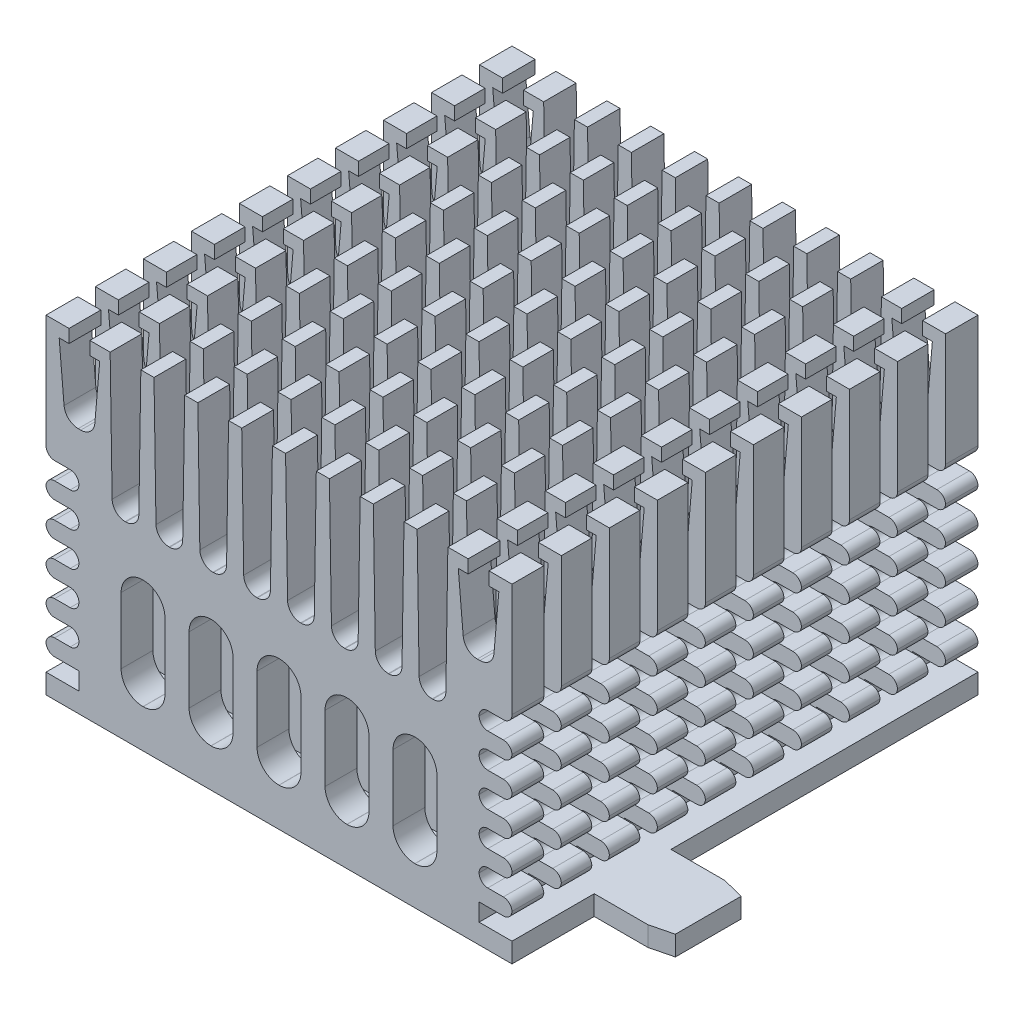
from build123d import *

# Parameters (mm, degrees)
CROQUIS3_W            = 42.5
CROQUIS3_H            = 42.5
EXTRUIR1_DEPTH        = 30
CORTAR_EXTRUIR1_DEPTH = 55
CROQUIS5_W            = 3.649717514
CROQUIS5_H            = 1.6
CORTAR_EXTRUIR2_DEPTH = 55
REDONDEO1_R           = 0.79
REDONDEO2_R           = 0.79
CORTAR_EXTRUIR3_DEPTH = 55
CROQUIS8_W            = 1.6
CROQUIS8_H            = 30.052187853
CORTAR_EXTRUIR4_DEPTH = 55
CROQUIS9_W            = 6.9
CROQUIS9_H            = 7
EXTRUIR2_DEPTH        = 1.8
CHAFL_N1_SIZE         = 0.5
CHAFL_N1_SIZE2        = 2.005390467
CHAFL_N2_SIZE         = 0.5
CHAFL_N2_SIZE2        = 2.005390467
CHAFL_N3_SIZE         = 0.5
CHAFL_N3_SIZE2        = 2.005390467
CHAFL_N4_SIZE         = 0.5
CHAFL_N4_SIZE2        = 2.005390467


with BuildPart() as part:
    # Croquis3 → Extruir1 (new body)
    with BuildSketch(Plane(origin=(0, 0, 0), x_dir=(1, 0, 0), z_dir=(0, 1, 0))):
        Rectangle(CROQUIS3_W, CROQUIS3_H)
    extrude(amount=EXTRUIR1_DEPTH)

    # Croquis4 → Cortar-Extruir1 (cut)
    with BuildSketch(Plane.XY.offset(21.25)):
        with BuildLine():
            Line((-19.15, 30), (-19.15, 28.8))
            Line((-19.15, 28.8), (-20.05, 28.8))
            Line((-20.05, 28.8), (-19.60282448, 23.677807681))
            ThreePointArc((-19.60282448, 23.677807681), (-19.189312121, 22.838993141), (-18.317712468, 22.5))
            Line((-18.317712468, 22.5), (-18.082287532, 22.5))
            ThreePointArc((-18.082287532, 22.5), (-17.210687879, 22.838993141), (-16.79717552, 23.677807681))
            Line((-16.79717552, 23.677807681), (-16.35, 28.8))
            Line((-16.35, 28.8), (-17.25, 28.8))
            Line((-17.25, 28.8), (-17.25, 30))
            Line((-17.25, 30), (-19.15, 30))
        make_face()
        with BuildLine():
            Line((-0.6, 30), (-0.781554927, 18.471262166))
            ThreePointArc((-0.781554927, 18.471262166), (-1.136601435, 17.641943981), (-1.971407394, 17.3))
            Line((-1.971407394, 17.3), (-2.028592606, 17.3))
            ThreePointArc((-2.028592606, 17.3), (-2.863398565, 17.641943981), (-3.218445073, 18.471262166))
            Line((-3.218445073, 18.471262166), (-3.4, 30))
            Line((-3.4, 30), (-0.6, 30))
        make_face()
        with BuildLine():
            Line((17.25, 30), (19.15, 30))
            Line((19.15, 30), (19.15, 28.8))
            Line((19.15, 28.8), (20.05, 28.8))
            Line((20.05, 28.8), (19.60282448, 23.677807681))
            ThreePointArc((19.60282448, 23.677807681), (19.189312121, 22.838993141), (18.317712468, 22.5))
            Line((18.317712468, 22.5), (18.082287532, 22.5))
            ThreePointArc((18.082287532, 22.5), (17.210687879, 22.838993141), (16.79717552, 23.677807681))
            Line((16.79717552, 23.677807681), (16.35, 28.8))
            Line((16.35, 28.8), (17.25, 28.8))
            Line((17.25, 28.8), (17.25, 30))
        make_face()
        with BuildLine():
            Line((-4.6, 30), (-4.781554927, 18.471262166))
            ThreePointArc((-4.781554927, 18.471262166), (-5.136601435, 17.641943981), (-5.971407394, 17.3))
            Line((-5.971407394, 17.3), (-6.028592606, 17.3))
            ThreePointArc((-6.028592606, 17.3), (-6.863398565, 17.641943981), (-7.218445073, 18.471262166))
            Line((-7.218445073, 18.471262166), (-7.4, 30))
            Line((-7.4, 30), (-4.6, 30))
        make_face()
        with BuildLine():
            Line((-8.6, 30), (-8.781554927, 18.471262166))
            ThreePointArc((-8.781554927, 18.471262166), (-9.136601435, 17.641943981), (-9.971407394, 17.3))
            Line((-9.971407394, 17.3), (-10.028592606, 17.3))
            ThreePointArc((-10.028592606, 17.3), (-10.863398565, 17.641943981), (-11.218445073, 18.471262166))
            Line((-11.218445073, 18.471262166), (-11.4, 30))
            Line((-11.4, 30), (-8.6, 30))
        make_face()
        with BuildLine():
            Line((-12.6, 30), (-12.781554927, 18.471262166))
            ThreePointArc((-12.781554927, 18.471262166), (-13.136601435, 17.641943981), (-13.971407394, 17.3))
            Line((-13.971407394, 17.3), (-14.028592606, 17.3))
            ThreePointArc((-14.028592606, 17.3), (-14.863398565, 17.641943981), (-15.218445073, 18.471262166))
            Line((-15.218445073, 18.471262166), (-15.4, 30))
            Line((-15.4, 30), (-12.6, 30))
        make_face()
        with BuildLine():
            Line((15.4, 30), (12.6, 30))
            Line((12.6, 30), (12.781554927, 18.471262166))
            ThreePointArc((12.781554927, 18.471262166), (13.136601435, 17.641943981), (13.971407394, 17.3))
            Line((13.971407394, 17.3), (14.028592606, 17.3))
            ThreePointArc((14.028592606, 17.3), (14.863398565, 17.641943981), (15.218445073, 18.471262166))
            Line((15.218445073, 18.471262166), (15.4, 30))
        make_face()
        with BuildLine():
            Line((11.4, 30), (8.6, 30))
            Line((8.6, 30), (8.781554927, 18.471262166))
            ThreePointArc((8.781554927, 18.471262166), (9.136601435, 17.641943981), (9.971407394, 17.3))
            Line((9.971407394, 17.3), (10.028592606, 17.3))
            ThreePointArc((10.028592606, 17.3), (10.863398565, 17.641943981), (11.218445073, 18.471262166))
            Line((11.218445073, 18.471262166), (11.4, 30))
        make_face()
        with BuildLine():
            Line((7.4, 30), (4.6, 30))
            Line((4.6, 30), (4.781554927, 18.471262166))
            ThreePointArc((4.781554927, 18.471262166), (5.136601435, 17.641943981), (5.971407394, 17.3))
            Line((5.971407394, 17.3), (6.028592606, 17.3))
            ThreePointArc((6.028592606, 17.3), (6.863398565, 17.641943981), (7.218445073, 18.471262166))
            Line((7.218445073, 18.471262166), (7.4, 30))
        make_face()
        with BuildLine():
            Line((3.4, 30), (0.6, 30))
            Line((0.6, 30), (0.781554927, 18.471262166))
            ThreePointArc((0.781554927, 18.471262166), (1.136601435, 17.641943981), (1.971407394, 17.3))
            Line((1.971407394, 17.3), (2.028592606, 17.3))
            ThreePointArc((2.028592606, 17.3), (2.863398565, 17.641943981), (3.218445073, 18.471262166))
            Line((3.218445073, 18.471262166), (3.4, 30))
        make_face()
    extrude(amount=-CORTAR_EXTRUIR1_DEPTH, mode=Mode.SUBTRACT)

    # Croquis5 → Cortar-Extruir2 (cut)
    with BuildSketch(Plane.XY.offset(21.25)):
        with Locations((-20.074858757, 18.1)):
            Rectangle(CROQUIS5_W, CROQUIS5_H)
        with Locations((-20.074858757, 15)):
            Rectangle(CROQUIS5_W, CROQUIS5_H)
        with Locations((-20.074858757, 11.9)):
            Rectangle(CROQUIS5_W, CROQUIS5_H)
        with Locations((-20.074858757, 8.8)):
            Rectangle(CROQUIS5_W, CROQUIS5_H)
        with Locations((-20.074858757, 5.7)):
            Rectangle(CROQUIS5_W, CROQUIS5_H)
        with Locations((-20.074858757, 2.6)):
            Rectangle(CROQUIS5_W, CROQUIS5_H)
        with Locations((20.074858757, 2.6)):
            Rectangle(CROQUIS5_W, CROQUIS5_H)
        with Locations((20.074858757, 5.7)):
            Rectangle(CROQUIS5_W, CROQUIS5_H)
        with Locations((20.074858757, 8.8)):
            Rectangle(CROQUIS5_W, CROQUIS5_H)
        with Locations((20.074858757, 11.9)):
            Rectangle(CROQUIS5_W, CROQUIS5_H)
        with Locations((20.074858757, 15)):
            Rectangle(CROQUIS5_W, CROQUIS5_H)
        with Locations((20.074858757, 18.1)):
            Rectangle(CROQUIS5_W, CROQUIS5_H)
    extrude(amount=-CORTAR_EXTRUIR2_DEPTH, mode=Mode.SUBTRACT)

    # Redondeo1
    # the kernel refuses this fillet: 0.79 mm, written as the material it adds along each edge
    with BuildSketch(Plane(origin=(-18.25, 18.9, 21.25), x_dir=(-1, 0, 0), z_dir=(0, 0, -1)), Plane(origin=(-18.25, 17.3, 21.25), x_dir=(0, 1, 0), z_dir=(0, 0, -1)), Plane(origin=(-18.25, 15.8, 21.25), x_dir=(-1, 0, 0), z_dir=(0, 0, -1)), Plane(origin=(-18.25, 14.2, 21.25), x_dir=(0, 1, 0), z_dir=(0, 0, -1)), Plane(origin=(-18.25, 12.7, 21.25), x_dir=(-1, 0, 0), z_dir=(0, 0, -1)), Plane(origin=(-18.25, 11.1, 21.25), x_dir=(0, 1, 0), z_dir=(0, 0, -1)), Plane(origin=(-18.25, 9.6, 21.25), x_dir=(-1, 0, 0), z_dir=(0, 0, -1)), Plane(origin=(-18.25, 8, 21.25), x_dir=(0, 1, 0), z_dir=(0, 0, -1)), Plane(origin=(-18.25, 6.5, 21.25), x_dir=(-1, 0, 0), z_dir=(0, 0, -1)), Plane(origin=(-18.25, 4.9, 21.25), x_dir=(0, 1, 0), z_dir=(0, 0, -1))) as redondeo1_piece_1:
        with BuildLine():
            CenterArc((REDONDEO1_R, -REDONDEO1_R), REDONDEO1_R, 90, 90)
            Line((0, -REDONDEO1_R), (0, 0))
            Line((0, 0), (REDONDEO1_R, 0))
        make_face()
    extrude(amount=42.5)
    # the kernel refuses this fillet: 0.79 mm, written as the material it takes off along each edge
    with BuildSketch(Plane(origin=(-21.25, 18.9, -23.225), x_dir=(0, 1, 0), z_dir=(0, 0, 1)), Plane(origin=(-21.25, 15.8, -23.225), x_dir=(0, 1, 0), z_dir=(0, 0, 1)), Plane(origin=(-21.25, 12.7, -23.225), x_dir=(0, 1, 0), z_dir=(0, 0, 1)), Plane(origin=(-21.25, 9.6, -23.225), x_dir=(0, 1, 0), z_dir=(0, 0, 1)), Plane(origin=(-21.25, 6.5, -23.225), x_dir=(0, 1, 0), z_dir=(0, 0, 1)), Plane(origin=(-21.25, 3.4, -23.225), x_dir=(0, 1, 0), z_dir=(0, 0, 1))) as redondeo1_2_piece_1:
        with BuildLine():
            CenterArc((REDONDEO1_R, -REDONDEO1_R), REDONDEO1_R, 90, 90)
            Line((0, -REDONDEO1_R), (0, 0))
            Line((0, 0), (REDONDEO1_R, 0))
        make_face()
    extrude(amount=46.45, mode=Mode.SUBTRACT)
    with BuildSketch(Plane(origin=(-21.25, 17.3, 23.225), x_dir=(1, 0, 0), z_dir=(0, 0, -1)), Plane(origin=(-21.25, 14.2, 23.225), x_dir=(1, 0, 0), z_dir=(0, 0, -1)), Plane(origin=(-21.25, 11.1, 23.225), x_dir=(1, 0, 0), z_dir=(0, 0, -1)), Plane(origin=(-21.25, 8, 23.225), x_dir=(1, 0, 0), z_dir=(0, 0, -1)), Plane(origin=(-21.25, 4.9, 23.225), x_dir=(1, 0, 0), z_dir=(0, 0, -1))) as redondeo1_2_piece_2:
        with BuildLine():
            CenterArc((REDONDEO1_R, REDONDEO1_R), REDONDEO1_R, 180, 90)
            Line((0, REDONDEO1_R), (0, 0))
            Line((0, 0), (REDONDEO1_R, 0))
        make_face()
    extrude(amount=46.45, mode=Mode.SUBTRACT)

    # Redondeo2
    # the kernel refuses this fillet: 0.79 mm, written as the material it adds along each edge
    with BuildSketch(Plane(origin=(18.25, 6.5, 21.25), x_dir=(1, 0, 0), z_dir=(0, 0, -1)), Plane(origin=(18.25, 4.9, 21.25), x_dir=(0, 1, 0), z_dir=(0, 0, -1)), Plane(origin=(18.25, 9.6, 21.25), x_dir=(1, 0, 0), z_dir=(0, 0, -1)), Plane(origin=(18.25, 8, 21.25), x_dir=(0, 1, 0), z_dir=(0, 0, -1)), Plane(origin=(18.25, 12.7, 21.25), x_dir=(1, 0, 0), z_dir=(0, 0, -1)), Plane(origin=(18.25, 11.1, 21.25), x_dir=(0, 1, 0), z_dir=(0, 0, -1)), Plane(origin=(18.25, 15.8, 21.25), x_dir=(1, 0, 0), z_dir=(0, 0, -1)), Plane(origin=(18.25, 14.2, 21.25), x_dir=(0, 1, 0), z_dir=(0, 0, -1)), Plane(origin=(18.25, 18.9, 21.25), x_dir=(1, 0, 0), z_dir=(0, 0, -1)), Plane(origin=(18.25, 17.3, 21.25), x_dir=(0, 1, 0), z_dir=(0, 0, -1))) as redondeo2_piece_1:
        with BuildLine():
            CenterArc((REDONDEO2_R, REDONDEO2_R), REDONDEO2_R, 180, 90)
            Line((0, REDONDEO2_R), (0, 0))
            Line((0, 0), (REDONDEO2_R, 0))
        make_face()
    extrude(amount=42.5)
    # the kernel refuses this fillet: 0.79 mm, written as the material it takes off along each edge
    with BuildSketch(Plane(origin=(21.25, 3.4, -23.225), x_dir=(0, 1, 0), z_dir=(0, 0, 1)), Plane(origin=(21.25, 6.5, -23.225), x_dir=(0, 1, 0), z_dir=(0, 0, 1)), Plane(origin=(21.25, 9.6, -23.225), x_dir=(0, 1, 0), z_dir=(0, 0, 1)), Plane(origin=(21.25, 12.7, -23.225), x_dir=(0, 1, 0), z_dir=(0, 0, 1)), Plane(origin=(21.25, 15.8, -23.225), x_dir=(0, 1, 0), z_dir=(0, 0, 1)), Plane(origin=(21.25, 18.9, -23.225), x_dir=(0, 1, 0), z_dir=(0, 0, 1))) as redondeo2_2_piece_1:
        with BuildLine():
            CenterArc((REDONDEO2_R, REDONDEO2_R), REDONDEO2_R, 180, 90)
            Line((0, REDONDEO2_R), (0, 0))
            Line((0, 0), (REDONDEO2_R, 0))
        make_face()
    extrude(amount=46.45, mode=Mode.SUBTRACT)
    with BuildSketch(Plane(origin=(21.25, 4.9, 23.225), x_dir=(-1, 0, 0), z_dir=(0, 0, -1)), Plane(origin=(21.25, 8, 23.225), x_dir=(-1, 0, 0), z_dir=(0, 0, -1)), Plane(origin=(21.25, 11.1, 23.225), x_dir=(-1, 0, 0), z_dir=(0, 0, -1)), Plane(origin=(21.25, 14.2, 23.225), x_dir=(-1, 0, 0), z_dir=(0, 0, -1)), Plane(origin=(21.25, 17.3, 23.225), x_dir=(-1, 0, 0), z_dir=(0, 0, -1))) as redondeo2_2_piece_2:
        with BuildLine():
            CenterArc((REDONDEO2_R, -REDONDEO2_R), REDONDEO2_R, 90, 90)
            Line((0, -REDONDEO2_R), (0, 0))
            Line((0, 0), (REDONDEO2_R, 0))
        make_face()
    extrude(amount=46.45, mode=Mode.SUBTRACT)

    # Croquis7 → Cortar-Extruir3 (cut)
    with BuildSketch(Plane.XY.offset(21.25)):
        with BuildLine():
            Line((-0.01, 13.5), (0.01, 13.5))
            ThreePointArc((0.01, 13.5), (1.417142495, 12.917142495), (2, 11.51))
            Line((2, 11.51), (2, 5.49))
            ThreePointArc((2, 5.49), (1.417142495, 4.082857505), (0.01, 3.5))
            Line((0.01, 3.5), (-0.01, 3.5))
            ThreePointArc((-0.01, 3.5), (-1.417142495, 4.082857505), (-2, 5.49))
            Line((-2, 5.49), (-2, 11.51))
            ThreePointArc((-2, 11.51), (-1.417142495, 12.917142495), (-0.01, 13.5))
        make_face()
        with BuildLine():
            Line((6.19, 13.5), (6.21, 13.5))
            ThreePointArc((6.21, 13.5), (7.617142495, 12.917142495), (8.2, 11.51))
            Line((8.2, 11.51), (8.2, 5.49))
            ThreePointArc((8.2, 5.49), (7.617142495, 4.082857505), (6.21, 3.5))
            Line((6.21, 3.5), (6.19, 3.5))
            ThreePointArc((6.19, 3.5), (4.782857505, 4.082857505), (4.2, 5.49))
            Line((4.2, 5.49), (4.2, 11.51))
            ThreePointArc((4.2, 11.51), (4.782857505, 12.917142495), (6.19, 13.5))
        make_face()
        with BuildLine():
            Line((12.39, 13.5), (12.41, 13.5))
            ThreePointArc((12.41, 13.5), (13.817142495, 12.917142495), (14.4, 11.51))
            Line((14.4, 11.51), (14.4, 5.49))
            ThreePointArc((14.4, 5.49), (13.817142495, 4.082857505), (12.41, 3.5))
            Line((12.41, 3.5), (12.39, 3.5))
            ThreePointArc((12.39, 3.5), (10.982857505, 4.082857505), (10.4, 5.49))
            Line((10.4, 5.49), (10.4, 11.51))
            ThreePointArc((10.4, 11.51), (10.982857505, 12.917142495), (12.39, 13.5))
        make_face()
        with BuildLine():
            Line((-14.4, 11.51), (-14.4, 5.49))
            ThreePointArc((-14.4, 5.49), (-13.817142495, 4.082857505), (-12.41, 3.5))
            Line((-12.41, 3.5), (-12.39, 3.5))
            ThreePointArc((-12.39, 3.5), (-10.982857505, 4.082857505), (-10.4, 5.49))
            Line((-10.4, 5.49), (-10.4, 11.51))
            ThreePointArc((-10.4, 11.51), (-10.982857505, 12.917142495), (-12.39, 13.5))
            Line((-12.39, 13.5), (-12.41, 13.5))
            ThreePointArc((-12.41, 13.5), (-13.817142495, 12.917142495), (-14.4, 11.51))
        make_face()
        with BuildLine():
            Line((-8.2, 11.51), (-8.2, 5.49))
            ThreePointArc((-8.2, 5.49), (-7.617142495, 4.082857505), (-6.21, 3.5))
            Line((-6.21, 3.5), (-6.19, 3.5))
            ThreePointArc((-6.19, 3.5), (-4.782857505, 4.082857505), (-4.2, 5.49))
            Line((-4.2, 5.49), (-4.2, 11.51))
            ThreePointArc((-4.2, 11.51), (-4.782857505, 12.917142495), (-6.19, 13.5))
            Line((-6.19, 13.5), (-6.21, 13.5))
            ThreePointArc((-6.21, 13.5), (-7.617142495, 12.917142495), (-8.2, 11.51))
        make_face()
    extrude(amount=-CORTAR_EXTRUIR3_DEPTH, mode=Mode.SUBTRACT)

    # Croquis8 → Cortar-Extruir4 (cut)
    with BuildSketch(Plane(origin=(21.25, 0, 0), x_dir=(0, 0, -1), z_dir=(1, 0, 0))):
        with Locations((-17.55, 17.526093926)):
            Rectangle(CROQUIS8_W, CROQUIS8_H)
        with Locations((-13.17, 17.526093926)):
            Rectangle(CROQUIS8_W, CROQUIS8_H)
        with Locations((-8.79, 17.526093926)):
            Rectangle(CROQUIS8_W, CROQUIS8_H)
        with Locations((-4.41, 17.526093926)):
            Rectangle(CROQUIS8_W, CROQUIS8_H)
        with Locations((-0.03, 17.526093926)):
            Rectangle(CROQUIS8_W, CROQUIS8_H)
        with Locations((4.35, 17.526093926)):
            Rectangle(CROQUIS8_W, CROQUIS8_H)
        with Locations((8.73, 17.526093926)):
            Rectangle(CROQUIS8_W, CROQUIS8_H)
        with Locations((13.11, 17.526093926)):
            Rectangle(CROQUIS8_W, CROQUIS8_H)
        with Locations((17.49, 17.526093926)):
            Rectangle(CROQUIS8_W, CROQUIS8_H)
    extrude(amount=-CORTAR_EXTRUIR4_DEPTH, mode=Mode.SUBTRACT)

    # Croquis9 → Extruir2 (add)
    with BuildSketch(Plane.XZ):
        with Locations((-24.7, -10.25)):
            Rectangle(CROQUIS9_W, CROQUIS9_H)
        with Locations((24.7, 10.25)):
            Rectangle(CROQUIS9_W, CROQUIS9_H)
    extrude(amount=-EXTRUIR2_DEPTH)

    # Chaflán1
    chafl_n1_edges = [part.edges().sort_by_distance(p)[0] for p in [
        (28.15, 0.9, 13.75),
    ]]
    chafl_n1_side = [part.faces().sort_by_distance(p)[0] for p in [
        (28.15, 0.9, 10.25),
    ]]
    chamfer(chafl_n1_edges, length=CHAFL_N1_SIZE, length2=CHAFL_N1_SIZE2, reference=chafl_n1_side[0])

    # Chaflán2
    chafl_n2_edges = [part.edges().sort_by_distance(p)[0] for p in [
        (28.15, 0.9, 6.75),
    ]]
    chafl_n2_side = [part.faces().sort_by_distance(p)[0] for p in [
        (28.15, 0.9, 10),
    ]]
    chamfer(chafl_n2_edges, length=CHAFL_N2_SIZE, length2=CHAFL_N2_SIZE2, reference=chafl_n2_side[0])

    # Chaflán3
    chafl_n3_edges = [part.edges().sort_by_distance(p)[0] for p in [
        (-28.15, 0.9, -6.75),
    ]]
    chafl_n3_side = [part.faces().sort_by_distance(p)[0] for p in [
        (-28.15, 0.9, -10.25),
    ]]
    chamfer(chafl_n3_edges, length=CHAFL_N3_SIZE, length2=CHAFL_N3_SIZE2, reference=chafl_n3_side[0])

    # Chaflán4
    chafl_n4_edges = [part.edges().sort_by_distance(p)[0] for p in [
        (-28.15, 0.9, -13.75),
    ]]
    chafl_n4_side = [part.faces().sort_by_distance(p)[0] for p in [
        (-28.15, 0.9, -10.5),
    ]]
    chamfer(chafl_n4_edges, length=CHAFL_N4_SIZE, length2=CHAFL_N4_SIZE2, reference=chafl_n4_side[0])


solid = part.part
